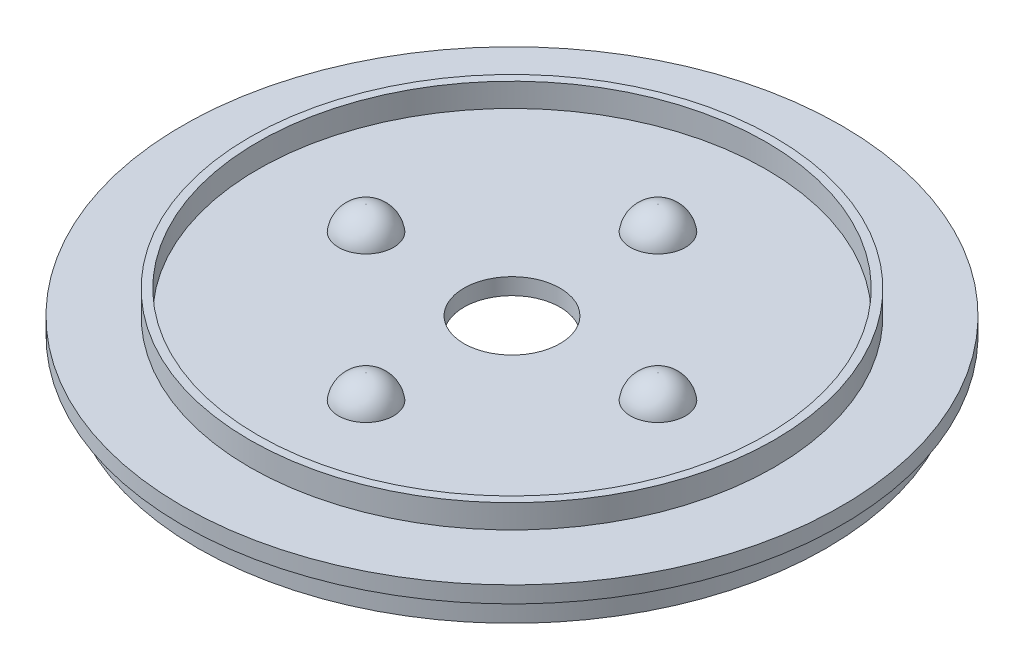
from build123d import *

# Parameters (mm, degrees)
SKETCH3_R           = 60
SKETCH3_R_2         = 8.75
BOSS_EXTRUDE1_DEPTH = 3
SKETCH4_R           = 57.25
SKETCH4_R_2         = 55.75
BOSS_EXTRUDE2_DEPTH = 5
SKETCH5_R           = 22
SKETCH5_R_2         = 20.5
BOSS_EXTRUDE3_DEPTH = 7
SKETCH6_R           = 47.75
SKETCH6_R_2         = 46.25
BOSS_EXTRUDE4_DEPTH = 4.3
SKETCH10_R          = 5
BOSS_EXTRUDE5_DEPTH = 4.3
FILLET2_R           = 5


with BuildPart() as part:
    # Sketch3 → Boss-Extrude1 (new body)
    with BuildSketch(Plane(origin=(0, 0, 0), x_dir=(1, 0, 0), z_dir=(0, 1, 0))):
        with Locations(Location((0, 0, 0), (0, 0, 270))):
            Circle(SKETCH3_R)
        with Locations(Location((0, 0, 0), (0, 0, 270))):
            Circle(SKETCH3_R_2, mode=Mode.SUBTRACT)
    extrude(amount=BOSS_EXTRUDE1_DEPTH)

    # Sketch4 → Boss-Extrude2 (add)
    with BuildSketch(Plane.XZ):
        with Locations(Location((0, 0, 0), (0, 0, 90))):
            Circle(SKETCH4_R)
        with Locations(Location((0, 0, 0), (0, 0, 270))):
            Circle(SKETCH4_R_2, mode=Mode.SUBTRACT)
    extrude(amount=BOSS_EXTRUDE2_DEPTH)

    # Sketch5 → Boss-Extrude3 (add)
    with BuildSketch(Plane.XZ):
        with Locations(Location((0, 0, 0), (0, 0, 90))):
            Circle(SKETCH5_R)
        with Locations(Location((0, 0, 0), (0, 0, 270))):
            Circle(SKETCH5_R_2, mode=Mode.SUBTRACT)
    extrude(amount=BOSS_EXTRUDE3_DEPTH)

    # Sketch6 → Boss-Extrude4 (add)
    with BuildSketch(Plane(origin=(0, 3, 0), x_dir=(1, 0, 0), z_dir=(0, 1, 0))):
        with Locations(Location((0, 0, 0), (0, 0, 90))):
            Circle(SKETCH6_R)
        with Locations(Location((0, 0, 0), (0, 0, 90))):
            Circle(SKETCH6_R_2, mode=Mode.SUBTRACT)
    extrude(amount=BOSS_EXTRUDE4_DEPTH)

    # Sketch10 → Boss-Extrude5 (add)
    with BuildSketch(Plane(origin=(0, 3, 0), x_dir=(1, 0, 0), z_dir=(0, 1, 0))):
        with Locations(Location((0, 26.574961269, 0), (0, 0, 270))):
            Circle(SKETCH10_R)
        with Locations(Location((26.574961269, 0, 0), (0, 0, 270))):
            Circle(SKETCH10_R)
        with Locations(Location((0, -26.574961269, 0), (0, 0, 270))):
            Circle(SKETCH10_R)
        with Locations(Location((-26.574961269, 0, 0), (0, 0, 270))):
            Circle(SKETCH10_R)
    extrude(amount=BOSS_EXTRUDE5_DEPTH)

    # Fillet2
    # the kernel refuses this fillet: 5 mm, written as the material it takes off along each edge
    with BuildSketch(Plane(origin=(0, 7.3, -26.574961269), x_dir=(0, 0, 1), z_dir=(-1, 0, 0))) as fillet2_piece_1:
        with BuildLine():
            CenterArc((0.049242482, -5), FILLET2_R, 8.047846247, 81.952153753)
            Line((0.049242482, 0), (0.049242482, 0.1))
            Line((0.049242482, 0.1), (5, 0.1))
            Line((5, 0.1), (5.1, 0))
            ThreePointArc((5.1, 0), (5.1, -2.15), (5.09901515, -4.286))
            Line((5.09901515, -4.286), (5, -4.3))
        make_face()
    revolve(axis=Axis((0, 7.3, -26.574961269), (0, 1, 0)), mode=Mode.SUBTRACT)
    with BuildSketch(Plane(origin=(26.574961269, 7.3, 0), x_dir=(0, 0, 1), z_dir=(-1, 0, 0))) as fillet2_piece_2:
        with BuildLine():
            CenterArc((0.049242482, -5), FILLET2_R, 8.047846247, 81.952153753)
            Line((0.049242482, 0), (0.049242482, 0.1))
            Line((0.049242482, 0.1), (5, 0.1))
            Line((5, 0.1), (5.1, 0))
            ThreePointArc((5.1, 0), (5.1, -2.15), (5.09901515, -4.286))
            Line((5.09901515, -4.286), (5, -4.3))
        make_face()
    revolve(axis=Axis((26.574961269, 7.3, 0), (0, 1, 0)), mode=Mode.SUBTRACT)
    with BuildSketch(Plane(origin=(0, 7.3, 26.574961269), x_dir=(0, 0, 1), z_dir=(-1, 0, 0))) as fillet2_piece_3:
        with BuildLine():
            CenterArc((0.049242482, -5), FILLET2_R, 8.047846247, 81.952153753)
            Line((0.049242482, 0), (0.049242482, 0.1))
            Line((0.049242482, 0.1), (5, 0.1))
            Line((5, 0.1), (5.1, 0))
            ThreePointArc((5.1, 0), (5.1, -2.15), (5.09901515, -4.286))
            Line((5.09901515, -4.286), (5, -4.3))
        make_face()
    revolve(axis=Axis((0, 7.3, 26.574961269), (0, 1, 0)), mode=Mode.SUBTRACT)
    with BuildSketch(Plane(origin=(-26.574961269, 7.3, 0), x_dir=(0, 0, 1), z_dir=(-1, 0, 0))) as fillet2_piece_4:
        with BuildLine():
            CenterArc((0.049242482, -5), FILLET2_R, 8.047846247, 81.952153753)
            Line((0.049242482, 0), (0.049242482, 0.1))
            Line((0.049242482, 0.1), (5, 0.1))
            Line((5, 0.1), (5.1, 0))
            ThreePointArc((5.1, 0), (5.1, -2.15), (5.09901515, -4.286))
            Line((5.09901515, -4.286), (5, -4.3))
        make_face()
    revolve(axis=Axis((-26.574961269, 7.3, 0), (0, 1, 0)), mode=Mode.SUBTRACT)


solid = part.part
